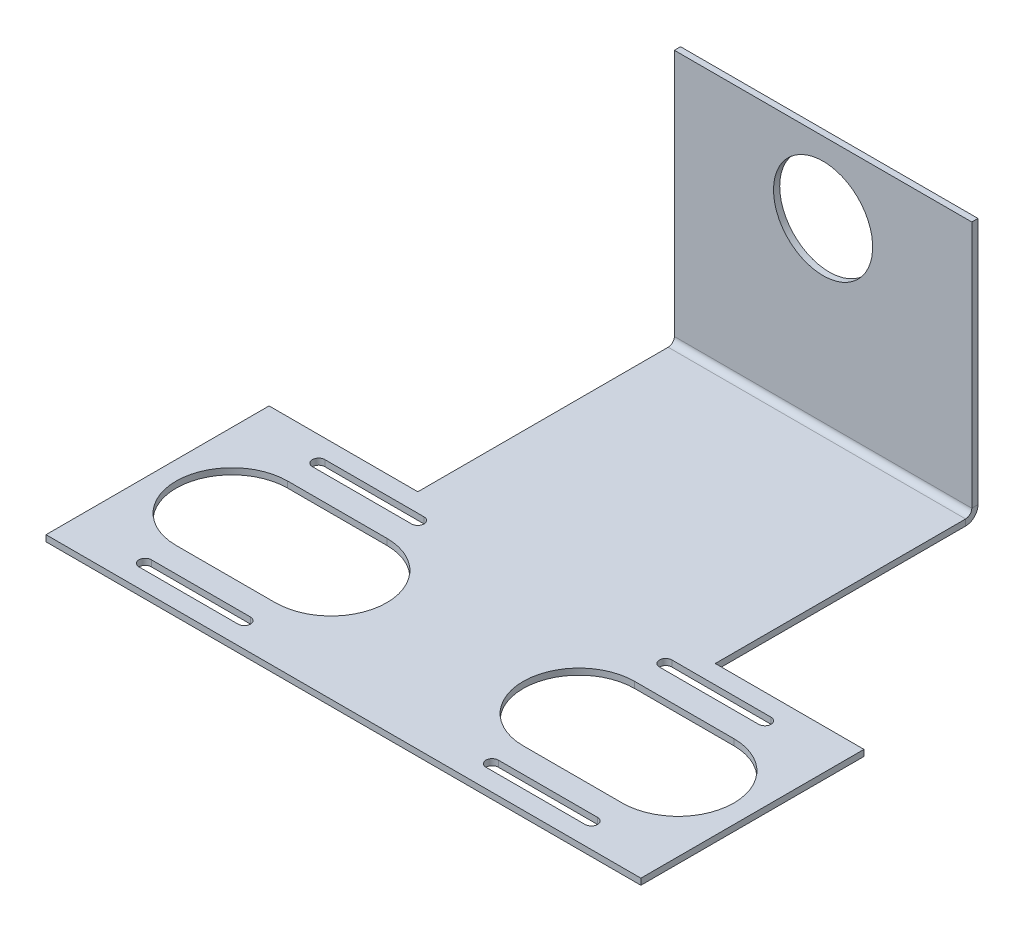
from build123d import *

# Parameters (mm, degrees)
SKETCH1_W              = 304.8
SKETCH1_H              = 114.3
BOSS_EXTRUDE1_DEPTH    = 3.175
CUT_EXTRUDE1_DEPTH     = 163.79423554
SKETCH3_W              = 152.4
SKETCH3_H              = 3.175
BOSS_EXTRUDE2_DEPTH    = 131.445
SKETCH4_W              = 152.4
SKETCH4_H              = 3.175
BOSS_EXTRUDE3_DEPTH    = 133.35
CONVERT_SOLID1_START   = -76.2
CONVERT_SOLID1_DEPTH   = 152.4
CONVERT_SOLID1_2_DEPTH = 152.4
SKETCH5_R              = 25.4
CUT_EXTRUDE2_DEPTH     = 321.888062882


# Read off the part's stored shape, not the designer's step: Convert-Solid1
with BuildPart() as part:
    # Sketch1 → Boss-Extrude1 (new body)
    with BuildSketch(Plane(origin=(0, 0, 0), x_dir=(1, 0, 0), z_dir=(0, 1, 0))):
        Rectangle(SKETCH1_W, SKETCH1_H)
    extrude(amount=BOSS_EXTRUDE1_DEPTH)

    # Sketch2 → Cut-Extrude1 (cut, through all)
    with BuildSketch(Plane(origin=(0, 3.175, 0), x_dir=(1, 0, 0), z_dir=(0, 1, 0))):
        with BuildLine():
            Line((-114.3, -41.275), (-63.5, -41.275))
            ThreePointArc((-63.5, -41.275), (-60.325, -44.45), (-63.5, -47.625))
            Line((-63.5, -47.625), (-114.3, -47.625))
            ThreePointArc((-114.3, -47.625), (-117.475, -44.45), (-114.3, -41.275))
        make_face()
        with BuildLine():
            Line((-114.3, 47.625), (-63.5, 47.625))
            ThreePointArc((-63.5, 47.625), (-60.325, 44.45), (-63.5, 41.275))
            Line((-63.5, 41.275), (-114.3, 41.275))
            ThreePointArc((-114.3, 41.275), (-117.475, 44.45), (-114.3, 47.625))
        make_face()
        with BuildLine():
            Line((-114.3, 28.575), (-63.5, 28.575))
            ThreePointArc((-63.5, 28.575), (-34.925, 0), (-63.5, -28.575))
            Line((-63.5, -28.575), (-114.3, -28.575))
            ThreePointArc((-114.3, -28.575), (-142.875, 0), (-114.3, 28.575))
        make_face()
    cut_extrude1 = extrude(amount=-CUT_EXTRUDE1_DEPTH, mode=Mode.SUBTRACT)

    # Sketch3 → Boss-Extrude2 (add)
    with BuildSketch(Plane.XY.offset(-57.15)):
        with Locations((0, 1.5875)):
            Rectangle(SKETCH3_W, SKETCH3_H)
    extrude(amount=-BOSS_EXTRUDE2_DEPTH)

    # Sketch4 → Boss-Extrude3 (add)
    with BuildSketch(Plane(origin=(0, 0, 0), x_dir=(-1, 0, 0), z_dir=(0, -1, 0))):
        with Locations((0, 190.1825)):
            Rectangle(SKETCH4_W, SKETCH4_H)
    extrude(amount=-BOSS_EXTRUDE3_DEPTH)

    # Convert-Solid1 outline → Convert-Solid1 (cut)
    with BuildSketch(Plane.YZ.offset(CONVERT_SOLID1_START)):
        with BuildLine():
            ThreePointArc((6.35, -191.77), (1.859871939, -189.910128061), (0, -185.42))
            Line((0, -185.42), (0, -191.77))
            Line((0, -191.77), (6.35, -191.77))
        make_face()
    extrude(amount=CONVERT_SOLID1_DEPTH, mode=Mode.SUBTRACT)

    # Convert-Solid1 2 outline → Convert-Solid1 2 (add)
    with BuildSketch(Plane.YZ.offset(CONVERT_SOLID1_START)):
        with BuildLine():
            ThreePointArc((6.35, -188.595), (4.10493597, -187.66506403), (3.175, -185.42))
            Line((3.175, -185.42), (3.175, -188.595))
            Line((3.175, -188.595), (6.35, -188.595))
        make_face()
    extrude(amount=CONVERT_SOLID1_2_DEPTH)

    # Mirror1: Cut-Extrude1 across plane
    add(cut_extrude1.mirror(Plane(origin=(0, 0, 0), x_dir=(0, 0, 1), z_dir=(1, 0, 0))), mode=Mode.SUBTRACT)

    # Sketch5 → Cut-Extrude2 (cut, through all)
    with BuildSketch(Plane(origin=(0, 0, -191.77), x_dir=(-1, 0, 0), z_dir=(0, 0, -1))):
        with Locations((0, 96.8375)):
            Circle(SKETCH5_R)
    extrude(amount=-CUT_EXTRUDE2_DEPTH, mode=Mode.SUBTRACT)


solid = part.part
